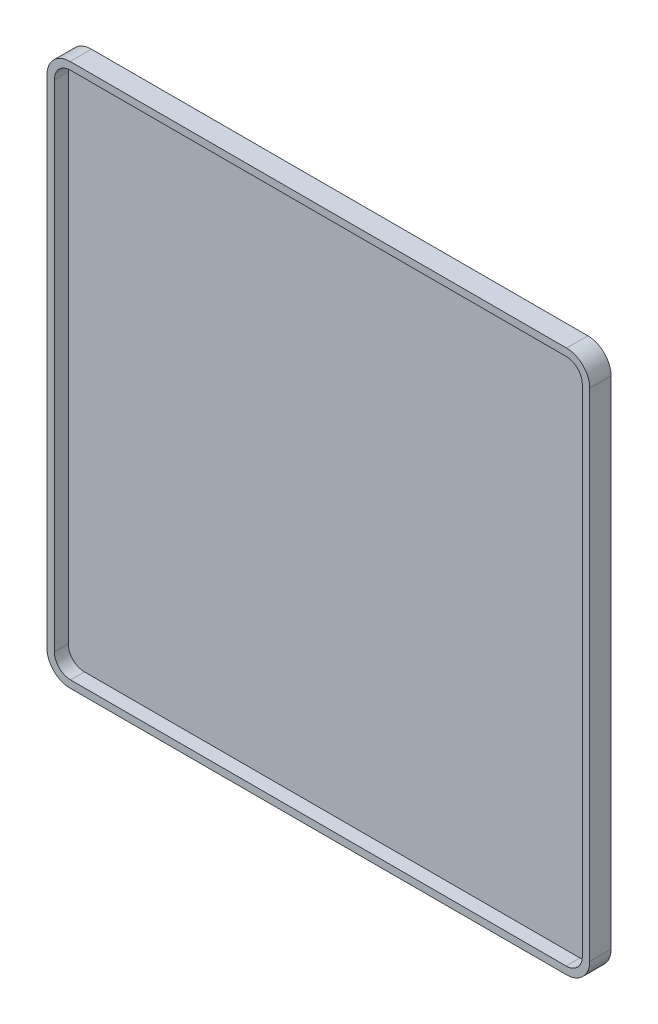
from build123d import *

# Parameters (mm, degrees)
SURFACE_EXTRUDE1_1_DEPTH = 3
THICKEN1_T1              = 1.6
THICKEN2_START           = -58.6
THICKEN2_OUTLINE_W       = 117.2
THICKEN2_OUTLINE_H       = 1.6
THICKEN2_DEPTH           = 117.2
FILLET2_R                = 5
FILLET3_R                = 3.5


# Read off the part's stored shape, not the designer's step: Thicken2
with BuildPart() as body_1:
    # Surface-Extrude1: a surface, the sketch's curves swept straight by 3 mm
    with BuildLine(Plane.XY, mode=Mode.PRIVATE) as surface_extrude1_1_path:
        Line((-57, 57), (57, 57))
        Line((57, 57), (57, -57))
        Line((57, -57), (-57, -57))
        Line((-57, -57), (-57, 57))
    surface_extrude1_1 = Shell.extrude(surface_extrude1_1_path.wire(), (0 * SURFACE_EXTRUDE1_1_DEPTH, 0 * SURFACE_EXTRUDE1_1_DEPTH, 1 * SURFACE_EXTRUDE1_1_DEPTH))
    add(Solid.thicken(surface_extrude1_1, THICKEN1_T1))

    # Thicken2 outline → Thicken2 (add)
    with BuildSketch(Plane.YZ.offset(THICKEN2_START)):
        with Locations((0, -0.8)):
            Rectangle(THICKEN2_OUTLINE_W, THICKEN2_OUTLINE_H)
    extrude(amount=THICKEN2_DEPTH)

    # Fillet2
    fillet2_edges = [body_1.edges().sort_by_distance(p)[0] for p in [
        (58.6, 58.6, 0.7),
        (-58.6, 58.6, 0.7),
        (58.6, -58.6, 0.7),
        (-58.6, -58.6, 0.7),
    ]]
    fillet(fillet2_edges, radius=FILLET2_R)

    # Fillet3
    fillet3_edges = [body_1.edges().sort_by_distance(p)[0] for p in [
        (57, 57, 1.5),
        (-57, 57, 1.5),
        (57, -57, 1.5),
        (-57, -57, 1.5),
    ]]
    fillet(fillet3_edges, radius=FILLET3_R)


solid = body_1.part
